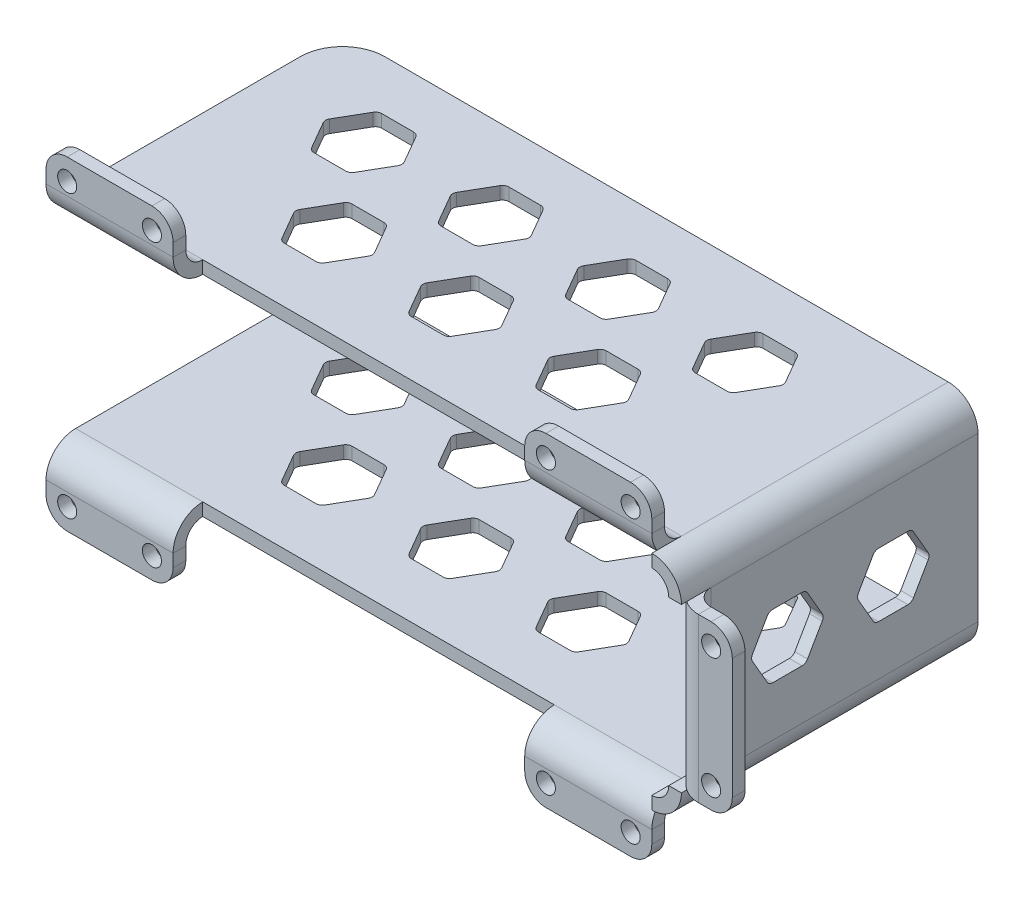
from build123d import *

# Parameters (mm, degrees)
SKETCH1_W                      = 150
SKETCH1_H                      = 70
BOSS_EXTRUDE1_DEPTH            = 3
EDGE_FLANGE1_STRIP_W           = 20
EDGE_FLANGE1_STRIP_H           = 3
EDGE_FLANGE1_STRIP_CUT_DEPTH   = 70
EDGE_FLANGE1_DEPTH             = 70
EDGE_FLANGE2_STRIP_W           = 20
EDGE_FLANGE2_STRIP_H           = 3
EDGE_FLANGE2_STRIP_CUT_DEPTH   = 70
EDGE_FLANGE2_DEPTH             = 70
EDGE_FLANGE3_STRIP_W           = 20
EDGE_FLANGE3_STRIP_H           = 3
EDGE_FLANGE3_STRIP_CUT_DEPTH   = 143
EDGE_FLANGE3_STRIP_2_W         = 20
EDGE_FLANGE3_STRIP_2_H         = 3
EDGE_FLANGE3_STRIP_CUT_2_DEPTH = 38.5
EDGE_FLANGE3_STRIP_3_W         = 20
EDGE_FLANGE3_STRIP_3_H         = 3
EDGE_FLANGE3_STRIP_CUT_3_DEPTH = 143
EDGE_FLANGE3_DEPTH             = 143
EDGE_FLANGE3_BEND_DEPTH        = 38.5
EDGE_FLANGE3_BEND_2_DEPTH      = 143
CUT_EXTRUDE1_START             = -70
CUT_EXTRUDE1_OUTLINE_W         = 83
CUT_EXTRUDE1_OUTLINE_H         = 76.5
CUT_EXTRUDE1_DEPTH             = 7
FILLET1_R                      = 5
SKETCH22_R                     = 2.25
CUT_EXTRUDE2_DEPTH             = 236
FILLET2_R                      = 10
CUT_EXTRUDE3_DEPTH             = 114.816738664
FILLET3_R                      = 1.5
CUT_EXTRUDE4_DEPTH             = 236
FILLET4_R                      = 1.5


# Read off the part's stored shape, not the designer's step: Cut-Extrude1
# Sheet-metal steps are written as plain solids
with BuildPart() as part:
    # Sketch1 → Boss-Extrude1 (new body)
    with BuildSketch(Plane(origin=(0, 0, 0), x_dir=(1, 0, 0), z_dir=(0, 1, 0))):
        Rectangle(SKETCH1_W, SKETCH1_H)
    extrude(amount=BOSS_EXTRUDE1_DEPTH)

    # Edge-Flange1 strip (across the edge) → Edge-Flange1 strip cut (cut)
    with BuildSketch(Plane(origin=(75, 3, 35), x_dir=(-1, 0, 0), z_dir=(0, 0, -1))):
        with Locations((-3, -1.5)):
            Rectangle(EDGE_FLANGE1_STRIP_W, EDGE_FLANGE1_STRIP_H)
    extrude(amount=EDGE_FLANGE1_STRIP_CUT_DEPTH, mode=Mode.SUBTRACT)

    # Edge-Flange1 section (across the edge) → Edge-Flange1 (add)
    with BuildSketch(Plane(origin=(75, 3, 35), x_dir=(-1, 0, 0), z_dir=(0, 0, -1))):
        with BuildLine():
            Line((0, 4), (0, 49.5))
            Line((0, 49.5), (3, 49.5))
            Line((3, 49.5), (3, 4))
            ThreePointArc((3, 4), (4.171572875, 1.171572875), (7, 0))
            Line((7, 0), (7, -3))
            ThreePointArc((7, -3), (2.050252532, -0.949747468), (0, 4))
        make_face()
    extrude(amount=EDGE_FLANGE1_DEPTH)

    # Edge-Flange2 strip (across the edge) → Edge-Flange2 strip cut (cut)
    with BuildSketch(Plane(origin=(72, 52.5, 35), x_dir=(0, -1, 0), z_dir=(0, 0, -1))):
        with Locations((-3, -1.5)):
            Rectangle(EDGE_FLANGE2_STRIP_W, EDGE_FLANGE2_STRIP_H)
    extrude(amount=EDGE_FLANGE2_STRIP_CUT_DEPTH, mode=Mode.SUBTRACT)

    # Edge-Flange2 section (across the edge) → Edge-Flange2 (add)
    with BuildSketch(Plane(origin=(72, 52.5, 35), x_dir=(0, -1, 0), z_dir=(0, 0, -1))):
        with BuildLine():
            Line((0, 4), (0, 147))
            Line((0, 147), (3, 147))
            Line((3, 147), (3, 4))
            ThreePointArc((3, 4), (4.171572875, 1.171572875), (7, 0))
            Line((7, 0), (7, -3))
            ThreePointArc((7, -3), (2.050252532, -0.949747468), (0, 4))
        make_face()
    extrude(amount=EDGE_FLANGE2_DEPTH)

    # Edge-Flange3 strip (across the edge) → Edge-Flange3 strip cut (cut)
    with BuildSketch(Plane(origin=(68, 0, 35), x_dir=(0, 0, -1), z_dir=(-1, 0, 0))):
        with Locations((-3, -1.5)):
            Rectangle(EDGE_FLANGE3_STRIP_W, EDGE_FLANGE3_STRIP_H)
    extrude(amount=EDGE_FLANGE3_STRIP_CUT_DEPTH, mode=Mode.SUBTRACT)

    # Edge-Flange3 strip 2 (across the edge) → Edge-Flange3 strip cut 2 (cut)
    with BuildSketch(Plane(origin=(75, 45.5, 35), x_dir=(0, 0, -1), z_dir=(0, -1, 0))):
        with Locations((-3, -1.5)):
            Rectangle(EDGE_FLANGE3_STRIP_2_W, EDGE_FLANGE3_STRIP_2_H)
    extrude(amount=EDGE_FLANGE3_STRIP_CUT_2_DEPTH, mode=Mode.SUBTRACT)

    # Edge-Flange3 strip 3 (across the edge) → Edge-Flange3 strip cut 3 (cut)
    with BuildSketch(Plane(origin=(-75, 52.5, 35), x_dir=(0, 0, -1), z_dir=(1, 0, 0))):
        with Locations((-3, -1.5)):
            Rectangle(EDGE_FLANGE3_STRIP_3_W, EDGE_FLANGE3_STRIP_3_H)
    extrude(amount=EDGE_FLANGE3_STRIP_CUT_3_DEPTH, mode=Mode.SUBTRACT)

    # Edge-Flange3 section (across the edge) → Edge-Flange3 (add)
    with BuildSketch(Plane(origin=(68, 0, 35), x_dir=(0, 0, -1), z_dir=(-1, 0, 0))):
        with BuildLine():
            Line((0, 4), (0, 12))
            Line((0, 12), (3, 12))
            Line((3, 12), (3, 4))
            ThreePointArc((3, 4), (4.171572875, 1.171572875), (7, 0))
            Line((7, 0), (7, -3))
            ThreePointArc((7, -3), (2.050252532, -0.949747468), (0, 4))
        make_face()
    extrude(amount=EDGE_FLANGE3_DEPTH)

    # Edge-Flange3 section 2 (across the edge) → Edge-Flange3 bend (add)
    with BuildSketch(Plane(origin=(75, 45.5, 35), x_dir=(0, 0, -1), z_dir=(0, -1, 0))):
        with BuildLine():
            Line((0, 4), (0, 12))
            Line((0, 12), (3, 12))
            Line((3, 12), (3, 4))
            ThreePointArc((3, 4), (4.171572875, 1.171572875), (7, 0))
            Line((7, 0), (7, -3))
            ThreePointArc((7, -3), (2.050252532, -0.949747468), (0, 4))
        make_face()
    extrude(amount=EDGE_FLANGE3_BEND_DEPTH)

    # Edge-Flange3 section 3 (across the edge) → Edge-Flange3 bend 2 (add)
    with BuildSketch(Plane(origin=(-75, 52.5, 35), x_dir=(0, 0, -1), z_dir=(1, 0, 0))):
        with BuildLine():
            Line((0, 4), (0, 12))
            Line((0, 12), (3, 12))
            Line((3, 12), (3, 4))
            ThreePointArc((3, 4), (4.171572875, 1.171572875), (7, 0))
            Line((7, 0), (7, -3))
            ThreePointArc((7, -3), (2.050252532, -0.949747468), (0, 4))
        make_face()
    extrude(amount=EDGE_FLANGE3_BEND_2_DEPTH)

    # Cut-Extrude1 outline → Cut-Extrude1 (cut)
    with BuildSketch(Plane(origin=(0, 0, -35), x_dir=(-1, 0, 0), z_dir=(0, 0, -1)).offset(CUT_EXTRUDE1_START)):
        with Locations((3.5, 26.25)):
            Rectangle(CUT_EXTRUDE1_OUTLINE_W, CUT_EXTRUDE1_OUTLINE_H)
    extrude(amount=CUT_EXTRUDE1_DEPTH, mode=Mode.SUBTRACT)

    # Fillet1
    fillet1_edges = [part.edges().sort_by_distance(p)[0] for p in [
        (68, -12, 33.5),
        (-75, -12, 33.5),
        (87, 45.5, 33.5),
        (87, 7, 33.5),
        (-75, 64.5, 33.5),
        (68, 64.5, 33.5),
        (-45, 64.5, 33.5),
        (38, 64.5, 33.5),
        (38, -12, 33.5),
        (-45, -12, 33.5),
    ]]
    fillet(fillet1_edges, radius=FILLET1_R)

    # Sketch22 → Cut-Extrude2 (cut)
    with BuildSketch(Plane(origin=(0, 0, 32), x_dir=(-1, 0, 0), z_dir=(0, 0, -1))):
        with Locations((50, 59.5)):
            Circle(SKETCH22_R)
        with Locations((70, 59.5)):
            Circle(SKETCH22_R)
        with Locations((-43, 59.5)):
            Circle(SKETCH22_R)
        with Locations((-63, 59.5)):
            Circle(SKETCH22_R)
        with Locations((-82, 40.5)):
            Circle(SKETCH22_R)
        with Locations((-82, 12)):
            Circle(SKETCH22_R)
        with Locations((-63, -7)):
            Circle(SKETCH22_R)
        with Locations((-43, -7)):
            Circle(SKETCH22_R)
        with Locations((70, -7)):
            Circle(SKETCH22_R)
        with Locations((50, -7)):
            Circle(SKETCH22_R)
    extrude(amount=-CUT_EXTRUDE2_DEPTH, mode=Mode.SUBTRACT)

    # Fillet2
    fillet2_edges = [part.edges().sort_by_distance(p)[0] for p in [
        (-75, 51, -35),
        (-75, 1.5, -35),
    ]]
    fillet(fillet2_edges, radius=FILLET2_R)

    # Sketch23 → Cut-Extrude3 (cut, through all)
    with BuildSketch(Plane(origin=(0, 52.5, 0), x_dir=(1, 0, 0), z_dir=(0, 1, 0))):
        Polygon((4.237604307, -7), (-0.381197846, 1), (-9.618802154, 1), (-14.237604307, -7), (-9.618802154, -15), (-0.381197846, -15), align=None)
        Polygon((-45.381197846, 23), (-54.618802154, 23), (-59.237604307, 15), (-54.618802154, 7), (-45.381197846, 7), (-40.762395693, 15), align=None)
        Polygon((-15.381197846, 23), (-24.618802154, 23), (-29.237604307, 15), (-24.618802154, 7), (-15.381197846, 7), (-10.762395693, 15), align=None)
        Polygon((14.618802154, 23), (5.381197846, 23), (0.762395693, 15), (5.381197846, 7), (14.618802154, 7), (19.237604307, 15), align=None)
        Polygon((44.618802154, 23), (35.381197846, 23), (30.762395693, 15), (35.381197846, 7), (44.618802154, 7), (49.237604307, 15), align=None)
        Polygon((-30.381197846, 1), (-39.618802154, 1), (-44.237604307, -7), (-39.618802154, -15), (-30.381197846, -15), (-25.762395693, -7), align=None)
        Polygon((34.237604307, -7), (29.618802154, 1), (20.381197846, 1), (15.762395693, -7), (20.381197846, -15), (29.618802154, -15), align=None)
    extrude(amount=-CUT_EXTRUDE3_DEPTH, mode=Mode.SUBTRACT)

    # Fillet3
    fillet3_edges = [part.edges().sort_by_distance(p)[0] for p in [
        (-30.381197846, 1.5, -1),
        (-25.762395693, 1.5, 7),
        (-30.381197846, 1.5, 15),
        (-39.618802154, 1.5, 15),
        (-44.237604307, 1.5, 7),
        (-39.618802154, 1.5, -1),
        (-30.381197846, 51, -1),
        (-25.762395693, 51, 7),
        (-30.381197846, 51, 15),
        (-39.618802154, 51, 15),
        (-44.237604307, 51, 7),
        (-39.618802154, 51, -1),
        (44.618802154, 1.5, -23),
        (49.237604307, 1.5, -15),
        (44.618802154, 1.5, -7),
        (35.381197846, 1.5, -7),
        (30.762395693, 1.5, -15),
        (35.381197846, 1.5, -23),
        (44.618802154, 51, -23),
        (49.237604307, 51, -15),
        (44.618802154, 51, -7),
        (35.381197846, 51, -7),
        (30.762395693, 51, -15),
        (35.381197846, 51, -23),
        (14.618802154, 1.5, -23),
        (19.237604307, 1.5, -15),
        (14.618802154, 1.5, -7),
        (5.381197846, 1.5, -7),
        (0.762395693, 1.5, -15),
        (5.381197846, 1.5, -23),
        (14.618802154, 51, -23),
        (19.237604307, 51, -15),
        (14.618802154, 51, -7),
        (5.381197846, 51, -7),
        (0.762395693, 51, -15),
        (5.381197846, 51, -23),
        (-15.381197846, 1.5, -23),
        (-10.762395693, 1.5, -15),
        (-15.381197846, 1.5, -7),
        (-24.618802154, 1.5, -7),
        (-29.237604307, 1.5, -15),
        (-24.618802154, 1.5, -23),
        (-15.381197846, 51, -23),
        (-10.762395693, 51, -15),
        (-15.381197846, 51, -7),
        (-24.618802154, 51, -7),
        (-29.237604307, 51, -15),
        (-24.618802154, 51, -23),
        (-9.618802154, 1.5, -1),
        (-0.381197846, 1.5, -1),
        (4.237604307, 1.5, 7),
        (-0.381197846, 1.5, 15),
        (-9.618802154, 1.5, 15),
        (-14.237604307, 1.5, 7),
        (-9.618802154, 51, -1),
        (-0.381197846, 51, -1),
        (4.237604307, 51, 7),
        (-0.381197846, 51, 15),
        (-9.618802154, 51, 15),
        (-14.237604307, 51, 7),
        (20.381197846, 1.5, -1),
        (29.618802154, 1.5, -1),
        (34.237604307, 1.5, 7),
        (29.618802154, 1.5, 15),
        (20.381197846, 1.5, 15),
        (15.762395693, 1.5, 7),
        (20.381197846, 51, -1),
        (29.618802154, 51, -1),
        (34.237604307, 51, 7),
        (29.618802154, 51, 15),
        (20.381197846, 51, 15),
        (15.762395693, 51, 7),
        (-45.381197846, 1.5, -23),
        (-40.762395693, 1.5, -15),
        (-45.381197846, 1.5, -7),
        (-54.618802154, 1.5, -7),
        (-59.237604307, 1.5, -15),
        (-54.618802154, 1.5, -23),
        (-45.381197846, 51, -23),
        (-40.762395693, 51, -15),
        (-45.381197846, 51, -7),
        (-54.618802154, 51, -7),
        (-59.237604307, 51, -15),
        (-54.618802154, 51, -23),
    ]]
    fillet(fillet3_edges, radius=FILLET3_R)

    # Sketch24 → Cut-Extrude4 (cut)
    with BuildSketch(Plane(origin=(75, 0, 0), x_dir=(0, 0, -1), z_dir=(1, 0, 0))):
        Polygon((19.330127019, 33.75), (10.669872981, 33.75), (6.339745962, 26.25), (10.669872981, 18.75), (19.330127019, 18.75), (23.660254038, 26.25), align=None)
        Polygon((-5.669872981, 33.75), (-14.330127019, 33.75), (-18.660254038, 26.25), (-14.330127019, 18.75), (-5.669872981, 18.75), (-1.339745962, 26.25), align=None)
    extrude(amount=-CUT_EXTRUDE4_DEPTH, mode=Mode.SUBTRACT)

    # Fillet4
    fillet4_edges = [part.edges().sort_by_distance(p)[0] for p in [
        (73.5, 33.75, -19.330127019),
        (73.5, 26.25, -23.660254038),
        (73.5, 18.75, -19.330127019),
        (73.5, 18.75, -10.669872981),
        (73.5, 26.25, -6.339745962),
        (73.5, 33.75, -10.669872981),
        (73.5, 33.75, 5.669872981),
        (73.5, 26.25, 1.339745962),
        (73.5, 18.75, 5.669872981),
        (73.5, 18.75, 14.330127019),
        (73.5, 26.25, 18.660254038),
        (73.5, 33.75, 14.330127019),
    ]]
    fillet(fillet4_edges, radius=FILLET4_R)


solid = part.part
